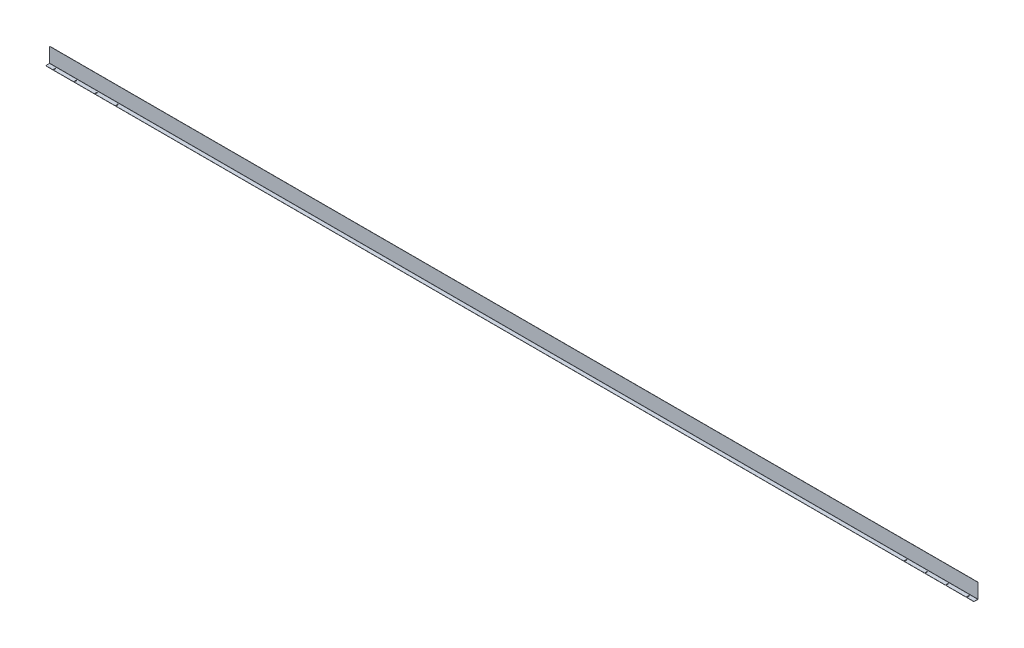
from build123d import *

# Parameters (mm, degrees)
BASE_FLANGE1_DEPTH       = 4736
FILLET1_R                = 5
SKETCH2_W                = 7
SKETCH2_H                = 35
CUT_EXTRUDE1_DEPTH       = 10
PATTERN_LINEAR_1_COUNT   = 4
PATTERN_LINEAR_1_PITCH   = 212.51
MIRROR_1_COPY_1_SKETCH_W = 7
MIRROR_1_COPY_1_SKETCH_H = 35
MIRROR_1_COPY_1_DEPTH    = 10
MIRROR_1_COPY_2_SKETCH_W = 7
MIRROR_1_COPY_2_SKETCH_H = 35
MIRROR_1_COPY_2_DEPTH    = 10
MIRROR_1_COPY_3_SKETCH_W = 7
MIRROR_1_COPY_3_SKETCH_H = 35
MIRROR_1_COPY_3_DEPTH    = 10


# Sheet-metal steps are written as plain solids
with BuildPart() as part:
    # Sketch1 → Base-Flange1 (new, symmetric)
    with BuildSketch(Plane(origin=(0, 0, 0), x_dir=(0, 0, -1), z_dir=(1, 0, 0))):
        with BuildLine():
            Line((-40, 0), (-1.3, 0))
            ThreePointArc((-1.3, 0), (-0.380761184, 0.380761184), (0, 1.3))
            Line((0, 1.3), (0, 150))
            Line((0, 150), (2, 150))
            Line((2, 150), (2, 1.3))
            ThreePointArc((2, 1.3), (1.033452378, -1.033452378), (-1.3, -2))
            Line((-1.3, -2), (-40, -2))
            Line((-40, -2), (-40, 0))
        make_face()
    extrude(amount=BASE_FLANGE1_DEPTH, both=True)

    # Fillet1
    fillet1_edges = [part.edges().sort_by_distance(p)[0] for p in [
        (4736, -1, 40),
        (-4736, -1, 40),
        (4736, 150, -1),
        (-4736, 150, -1),
    ]]
    fillet(fillet1_edges, radius=FILLET1_R)

    # Sketch2 → Cut-Extrude1 (cut)
    with BuildSketch(Plane(origin=(0, 0, 0), x_dir=(1, 0, 0), z_dir=(0, 1, 0))):
        with Locations((-4661, -30.5)):
            Rectangle(SKETCH2_W, SKETCH2_H)
    cut_extrude1 = extrude(amount=-CUT_EXTRUDE1_DEPTH, mode=Mode.SUBTRACT)

    # 阵列(线性)1: Cut-Extrude1 ×4
    with Locations(*[(i * PATTERN_LINEAR_1_PITCH, 0, 0) for i in range(1, PATTERN_LINEAR_1_COUNT)]):
        add(cut_extrude1, mode=Mode.SUBTRACT)

    # 镜向1: Cut-Extrude1 across plane
    add(cut_extrude1.mirror(Plane.ZY), mode=Mode.SUBTRACT)

    # 镜向1 copy 1 sketch → 镜向1 copy 1 (cut)
    with BuildSketch(Plane(origin=(-212.51, 0, 0), x_dir=(-1, 0, 0), z_dir=(0, 1, 0))):
        with Locations((-4661, 30.5)):
            Rectangle(MIRROR_1_COPY_1_SKETCH_W, MIRROR_1_COPY_1_SKETCH_H)
    extrude(amount=-MIRROR_1_COPY_1_DEPTH, mode=Mode.SUBTRACT)

    # 镜向1 copy 2 sketch → 镜向1 copy 2 (cut)
    with BuildSketch(Plane(origin=(-425.02, 0, 0), x_dir=(-1, 0, 0), z_dir=(0, 1, 0))):
        with Locations((-4661, 30.5)):
            Rectangle(MIRROR_1_COPY_2_SKETCH_W, MIRROR_1_COPY_2_SKETCH_H)
    extrude(amount=-MIRROR_1_COPY_2_DEPTH, mode=Mode.SUBTRACT)

    # 镜向1 copy 3 sketch → 镜向1 copy 3 (cut)
    with BuildSketch(Plane(origin=(-637.53, 0, 0), x_dir=(-1, 0, 0), z_dir=(0, 1, 0))):
        with Locations((-4661, 30.5)):
            Rectangle(MIRROR_1_COPY_3_SKETCH_W, MIRROR_1_COPY_3_SKETCH_H)
    extrude(amount=-MIRROR_1_COPY_3_DEPTH, mode=Mode.SUBTRACT)


solid = part.part
